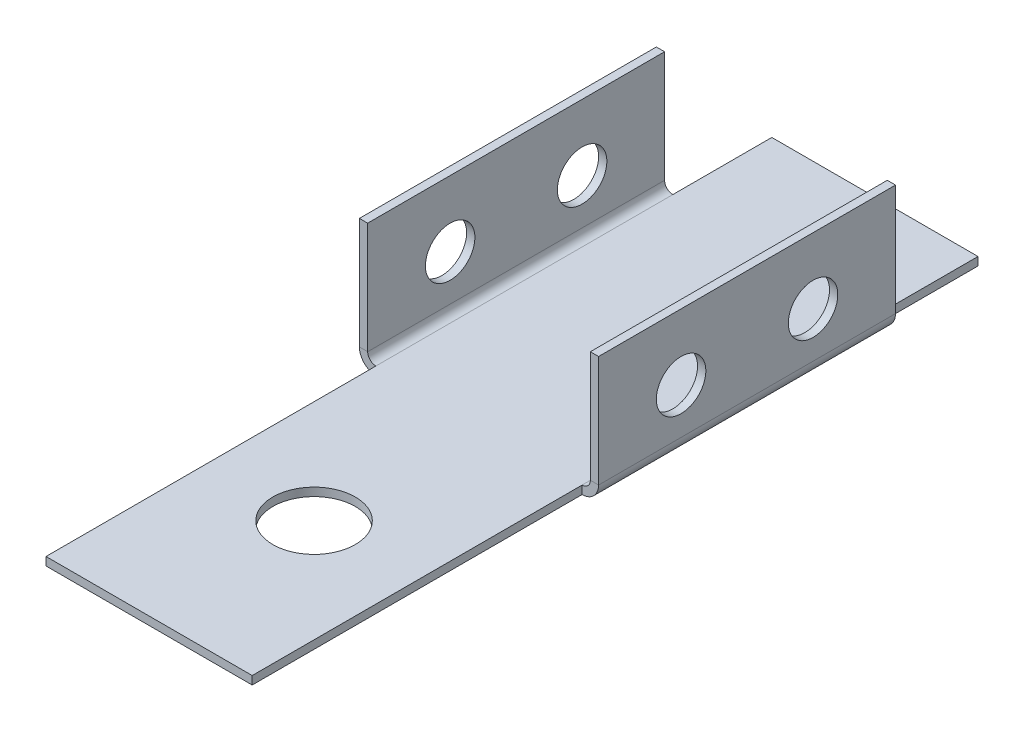
from build123d import *

# Parameters (mm, degrees)
BRIDA_BASE1_DEPTH           = 48
CROQUIS5_R                  = 2.5
CORTAR_EXTRUIR1_DEPTH       = 10
CORTAR_EXTRUIR2_START       = 28
CORTAR_EXTRUIR2_DEPTH       = 20
CORTAR_EXTRUIR2_2_DEPTH     = 10
CORTAR_EXTRUIR2_START_2     = -38.506869712
CORTAR_EXTRUIR2_3_OUTLINE_R = 1.5
CORTAR_EXTRUIR2_3_DEPTH     = 14.5
CROQUIS7_W                  = 12.5
CROQUIS7_H                  = 4
CORTAR_EXTRUIR4_DEPTH       = 10


with BuildPart() as part:
    # Brida base1: sheet metal written as solids
    # Croquis1 → Brida base1 (new body)
    with BuildSketch(Plane.XY):
        with BuildLine():
            Line((-38.506869712, -5.805989848), (-38.506869712, -12.555989848))
            ThreePointArc((-38.506869712, -12.555989848), (-38.213976494, -13.263096629), (-37.506869712, -13.555989848))
            Line((-37.506869712, -13.555989848), (-25.006869712, -13.555989848))
            ThreePointArc((-25.006869712, -13.555989848), (-24.299762931, -13.263096629), (-24.006869712, -12.555989848))
            Line((-24.006869712, -12.555989848), (-24.006869712, -5.805989848))
            Line((-24.006869712, -5.805989848), (-24.506869712, -5.805989848))
            Line((-24.506869712, -5.805989848), (-24.506869712, -12.555989848))
            ThreePointArc((-24.506869712, -12.555989848), (-24.653316322, -12.909543238), (-25.006869712, -13.055989848))
            Line((-25.006869712, -13.055989848), (-37.506869712, -13.055989848))
            ThreePointArc((-37.506869712, -13.055989848), (-37.860423103, -12.909543238), (-38.006869712, -12.555989848))
            Line((-38.006869712, -12.555989848), (-38.006869712, -5.805989848))
            Line((-38.006869712, -5.805989848), (-38.506869712, -5.805989848))
        make_face()
    extrude(amount=BRIDA_BASE1_DEPTH)

    # Croquis5 → Cortar-Extruir1 (cut)
    with BuildSketch(Plane(origin=(0, -13.055989848, 0), x_dir=(1, 0, 0), z_dir=(0, 1, 0))):
        with Locations(Location((-31.256869712, -38, 0), (0, 0, 180))):
            Circle(CROQUIS5_R)
    extrude(amount=-CORTAR_EXTRUIR1_DEPTH, mode=Mode.SUBTRACT)

    # Cortar-Extruir2: read off the stored shape, not the designer's step
    # Cortar-Extruir2 outline → Cortar-Extruir2 (cut)
    with BuildSketch(Plane.XY.offset(CORTAR_EXTRUIR2_START)):
        with BuildLine():
            Line((-37.506869712, -13.555989848), (-37.506869712, -13.055989848))
            ThreePointArc((-37.506869712, -13.055989848), (-37.860423103, -12.909543239), (-38.006869712, -12.555989848))
            Line((-38.006869712, -12.555989848), (-38.006869712, -5.805989848))
            Line((-38.006869712, -5.805989848), (-38.506869712, -5.805989848))
            Line((-38.506869712, -5.805989848), (-38.506869712, -12.555989848))
            ThreePointArc((-38.506869712, -12.555989848), (-38.213976493, -13.26309663), (-37.506869712, -13.555989848))
        make_face()
        with BuildLine():
            ThreePointArc((-24.506869712, -12.555989848), (-24.653316322, -12.909543238), (-25.006869712, -13.055989848))
            Line((-25.006869712, -13.055989848), (-25.006869712, -13.555989848))
            ThreePointArc((-25.006869712, -13.555989848), (-24.299762931, -13.263096629), (-24.006869712, -12.555989848))
            Line((-24.006869712, -12.555989848), (-24.006869712, -5.805989848))
            Line((-24.006869712, -5.805989848), (-24.506869712, -5.805989848))
            Line((-24.506869712, -5.805989848), (-24.506869712, -12.555989848))
        make_face()
    extrude(amount=CORTAR_EXTRUIR2_DEPTH, mode=Mode.SUBTRACT)

    # Cortar-Extruir2 2 outline → Cortar-Extruir2 2 (cut)
    with BuildSketch(Plane.XY):
        with BuildLine():
            Line((-37.506869712, -13.555989848), (-37.506869712, -13.055989848))
            ThreePointArc((-37.506869712, -13.055989848), (-37.860423103, -12.909543239), (-38.006869712, -12.555989848))
            Line((-38.006869712, -12.555989848), (-38.006869712, -5.805989848))
            Line((-38.006869712, -5.805989848), (-38.506869712, -5.805989848))
            Line((-38.506869712, -5.805989848), (-38.506869712, -12.555989848))
            ThreePointArc((-38.506869712, -12.555989848), (-38.213976493, -13.26309663), (-37.506869712, -13.555989848))
        make_face()
        with BuildLine():
            ThreePointArc((-24.506869712, -12.555989848), (-24.653316322, -12.909543238), (-25.006869712, -13.055989848))
            Line((-25.006869712, -13.055989848), (-25.006869712, -13.555989848))
            ThreePointArc((-25.006869712, -13.555989848), (-24.299762931, -13.263096629), (-24.006869712, -12.555989848))
            Line((-24.006869712, -12.555989848), (-24.006869712, -5.805989848))
            Line((-24.006869712, -5.805989848), (-24.506869712, -5.805989848))
            Line((-24.506869712, -5.805989848), (-24.506869712, -12.555989848))
        make_face()
    extrude(amount=CORTAR_EXTRUIR2_2_DEPTH, mode=Mode.SUBTRACT)

    # Cortar-Extruir2 3 outline → Cortar-Extruir2 3 (cut)
    with BuildSketch(Plane.YZ.offset(CORTAR_EXTRUIR2_START_2)):
        with Locations((-9.805989848, 23)):
            Circle(CORTAR_EXTRUIR2_3_OUTLINE_R)
        with Locations((-9.805989848, 15)):
            Circle(CORTAR_EXTRUIR2_3_OUTLINE_R)
    extrude(amount=CORTAR_EXTRUIR2_3_DEPTH, mode=Mode.SUBTRACT)

    # Croquis7 → Cortar-Extruir4 (cut)
    with BuildSketch(Plane(origin=(0, -13.055989848, 0), x_dir=(1, 0, 0), z_dir=(0, 1, 0))):
        with Locations((-31.256869712, -2)):
            Rectangle(CROQUIS7_W, CROQUIS7_H)
    extrude(amount=-CORTAR_EXTRUIR4_DEPTH, mode=Mode.SUBTRACT)


solid = part.part
